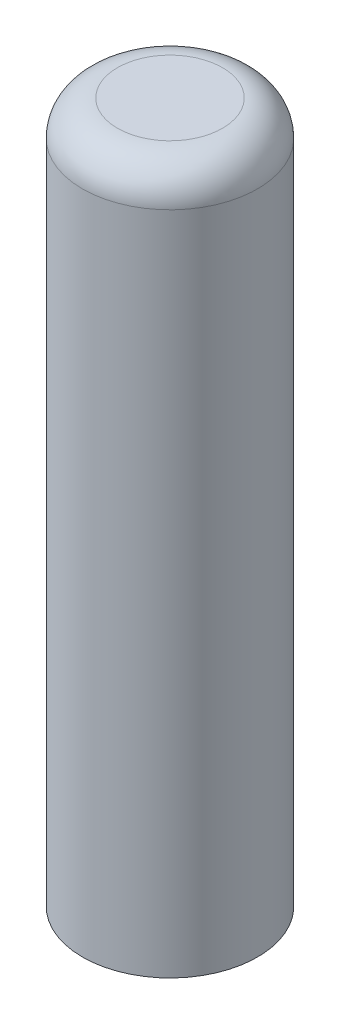
from build123d import *

# Parameters (mm, degrees)
SKETCH2_R           = 2.5
SKETCH2_W           = 1.95
SKETCH2_H           = 1.2
BOSS_EXTRUDE1_DEPTH = 10
FILLET1_R           = 1
SKETCH3_W           = 1.95
SKETCH3_H           = 1.2
BOSS_EXTRUDE5_DEPTH = 16


with BuildPart() as part:
    # Sketch2 → Boss-Extrude1 (new, symmetric)
    with BuildSketch(Plane(origin=(0, 0, 0), x_dir=(1, 0, 0), z_dir=(0, 1, 0))):
        Circle(SKETCH2_R)
        Rectangle(SKETCH2_W, SKETCH2_H, mode=Mode.SUBTRACT)
    extrude(amount=BOSS_EXTRUDE1_DEPTH, both=True)

    # Fillet1
    fillet1_edges = [part.edges().sort_by_distance(p)[0] for p in [
        (-2.5, 10, 0),
    ]]
    fillet(fillet1_edges, radius=FILLET1_R)

    # Sketch3 → Boss-Extrude5 (add)
    with BuildSketch(Plane(origin=(0, 10, 0), x_dir=(1, 0, 0), z_dir=(0, 1, 0))):
        Rectangle(SKETCH3_W, SKETCH3_H)
    extrude(amount=-BOSS_EXTRUDE5_DEPTH)


solid = part.part
